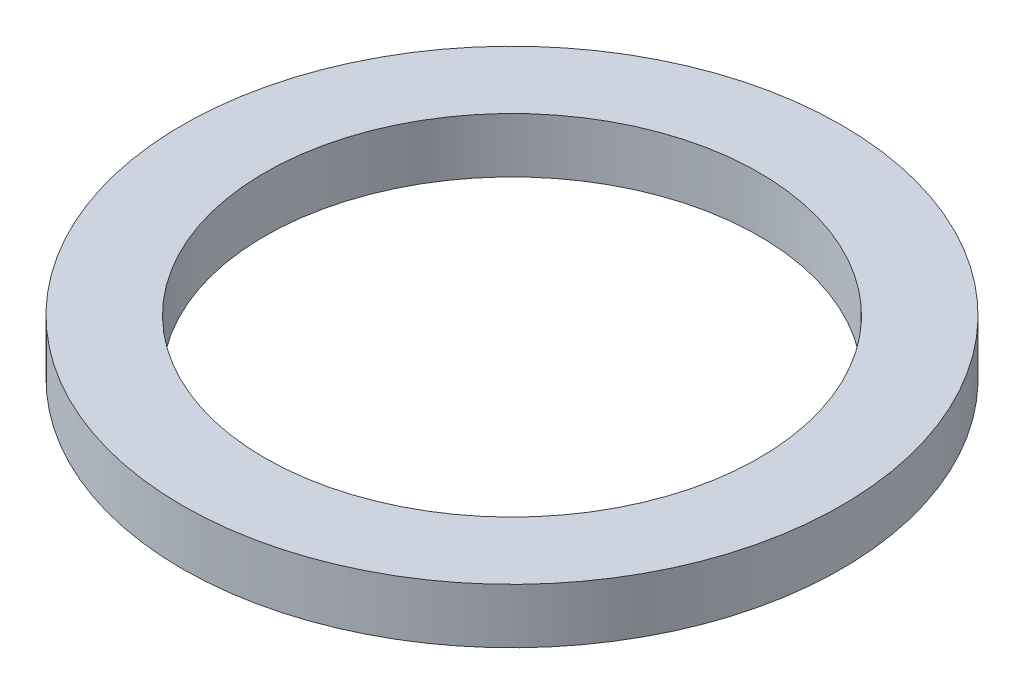
from build123d import *

# Parameters (mm, degrees)
SKETCH1_R           = 30
BOSS_EXTRUDE1_DEPTH = 5
SKETCH2_R           = 22.5
CUT_EXTRUDE1_DEPTH  = 43.720018727


with BuildPart() as part:
    # Sketch1 → Boss-Extrude1 (new body)
    with BuildSketch(Plane(origin=(0, 0, 0), x_dir=(1, 0, 0), z_dir=(0, 1, 0))):
        Circle(SKETCH1_R)
    extrude(amount=BOSS_EXTRUDE1_DEPTH)

    # Sketch2 → Cut-Extrude1 (cut, through all)
    with BuildSketch(Plane(origin=(0, 0, 0), x_dir=(1, 0, 0), z_dir=(0, 1, 0))):
        Circle(SKETCH2_R)
    extrude(amount=CUT_EXTRUDE1_DEPTH, mode=Mode.SUBTRACT)


solid = part.part
